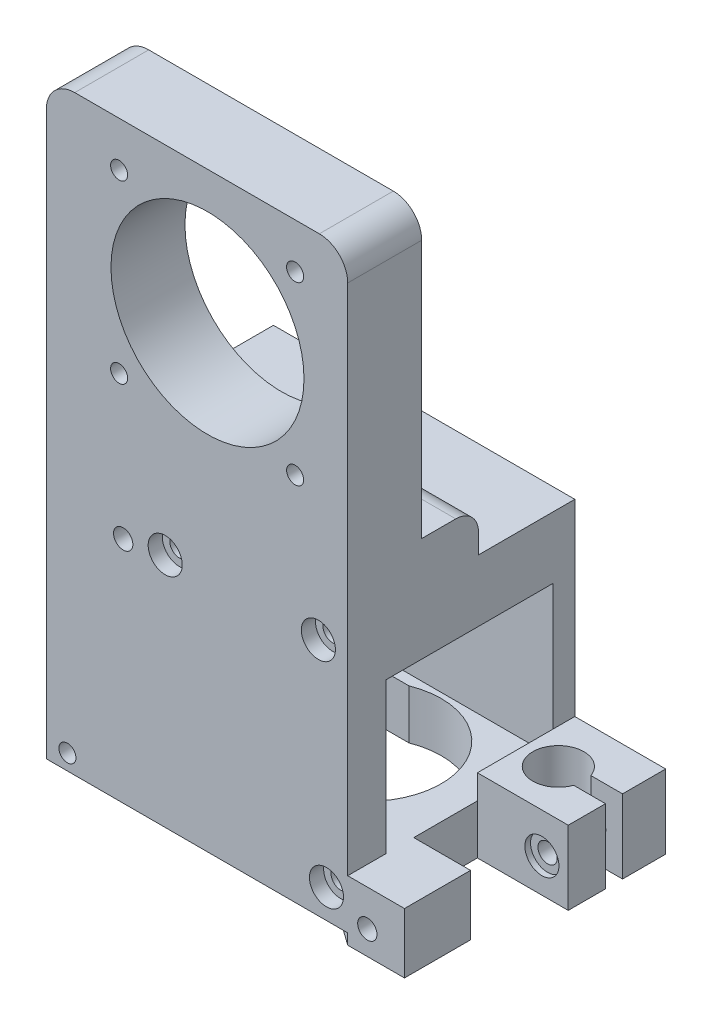
from build123d import *
from OCP.BRepAlgoAPI import BRepAlgoAPI_Cut
from OCP.TopTools import TopTools_ListOfShape

# Parameters (mm, degrees)
SKETCH1_W                     = 45
SKETCH1_H                     = 45
BOSS_EXTRUDE1_DEPTH           = 35
SKETCH2_R                     = 13
CUT_EXTRUDE3_DEPTH            = 35
SKETCH4_R                     = 1.7
CUT_EXTRUDE8_DEPTH            = 35
SKETCH7_R                     = 1.7
CUT_EXTRUDE9_DEPTH            = 35
SKETCH6_R                     = 1.7
CUT_EXTRUDE10_DEPTH           = 35
SKETCH5_R                     = 1.7
CUT_EXTRUDE11_DEPTH           = 35
CUT_EXTRUDE12_DEPTH           = 12
BOSS_EXTRUDE4_DEPTH           = 2
BOSS_EXTRUDE4_DEPTH_BACK      = 37.5
SKETCH14_W                    = 6
SKETCH14_H                    = 6
CUT_EXTRUDE17_START           = -7
SKETCH20_R                    = 2.2
CUT_EXTRUDE17_DEPTH           = 70.77141069
SKETCH21_R                    = 1.75
CUT_EXTRUDE18_DEPTH           = 2
BOSS_EXTRUDE5_DEPTH           = 44.571207257
BOSS_EXTRUDE5_DEPTH_BACK      = 1.562633388
SKETCH22_W                    = 53.082637552
SKETCH22_H                    = 40.002520942
SKETCH23_W                    = 29.449729346
SKETCH23_H                    = 26.517519529
CUT_EXTRUDE19_DEPTH           = 95.427299018
SKETCH25_R                    = 5
CUT_EXTRUDE24_DEPTH           = 2.6
SKETCH26_R                    = 8.1
CUT_EXTRUDE25_DEPTH           = 4
SKETCH27_R                    = 6.7
CUT_EXTRUDE28_DEPTH           = 6
SKETCH30_R                    = 13
CUT_EXTRUDE30_DEPTH           = 10.767560088
SKETCH31_W                    = 19.349450051
SKETCH31_H                    = 23.644133728
CUT_EXTRUDE31_DEPTH           = 9.664293754
SKETCH34_R                    = 1.5
CUT_EXTRUDE32_DEPTH           = 9
SKETCH37_W                    = 11.635024897
SKETCH37_H                    = 10.599921236
BOSS_EXTRUDE6_DEPTH           = 10
BOSS_EXTRUDE6_OTHER_WAY_DEPTH = 5
BOSS_EXTRUDE6_OTHER_WAY_TAPER = 29
SKETCH38_R                    = 1.700000001
CUT_EXTRUDE33_DEPTH           = 10
SKETCH39_R                    = 1.700000001
CUT_EXTRUDE34_DEPTH           = 88.0662855
SKETCH40_W                    = 17.159872711
SKETCH40_H                    = 13
BOSS_EXTRUDE7_DEPTH           = 16
SKETCH41_R                    = 4.5
CUT_EXTRUDE35_DEPTH           = 15
SKETCH42_W                    = 9.331425876
SKETCH42_H                    = 3
CUT_EXTRUDE36_DEPTH           = 15
CUT_EXTRUDE37_DEPTH           = 5
SKETCH44_R                    = 1.7
CUT_EXTRUDE38_DEPTH           = 23
CUT_EXTRUDE39_DEPTH           = 5
CUT_EXTRUDE40_DEPTH           = 5
CUT_EXTRUDE41_DEPTH           = 5
SKETCH53_R                    = 1.7
CUT_EXTRUDE42_DEPTH           = 90.646740997
SKETCH52_R                    = 1.7
CUT_EXTRUDE43_DEPTH           = 90.646740997
SKETCH51_R                    = 1.7
CUT_EXTRUDE44_DEPTH           = 90.646740997
CUT_EXTRUDE46_DEPTH           = 5
SKETCH57_R                    = 3
CUT_EXTRUDE48_DEPTH           = 2.5
SKETCH58_R                    = 3
CUT_EXTRUDE49_DEPTH           = 2.5
SKETCH59_R                    = 3
CUT_EXTRUDE50_DEPTH           = 2.5
SKETCH60_R                    = 3
CUT_EXTRUDE51_DEPTH           = 1
SKETCH61_W                    = 6.542017971
SKETCH61_H                    = 14.030300317
CUT_EXTRUDE52_DEPTH           = 6.5
SKETCH67_W                    = 5.604230097
SKETCH67_H                    = 8.996545788
BOSS_EXTRUDE8_DEPTH           = 33
SKETCH68_W                    = 5.604230097
SKETCH68_H                    = 9.400155495
BOSS_EXTRUDE9_DEPTH           = 33
SKETCH63_R                    = 1.7
CUT_EXTRUDE55_DEPTH           = 102.92049818
SKETCH62_R                    = 1.7
CUT_EXTRUDE56_DEPTH           = 102.92049818
SKETCH69_R                    = 3
CUT_EXTRUDE57_DEPTH           = 2.5
CUT_EXTRUDE58_DEPTH           = 2.5
SKETCH71_R                    = 3
CUT_EXTRUDE59_DEPTH           = 1
SKETCH73_R                    = 1.5
CUT_EXTRUDE61_DEPTH           = 5
SKETCH79_W                    = 95.658931194
SKETCH79_H                    = 51.290788201
CUT_EXTRUDE62_DEPTH           = 59
SKETCH80_W                    = 53.082637552
SKETCH80_H                    = 13.031868173
BOSS_EXTRUDE10_DEPTH          = 58
FILLET1_R                     = 5
SKETCH84_R                    = 17
CUT_EXTRUDE63_DEPTH           = 22
SKETCH85_R                    = 1.5
CUT_EXTRUDE64_DEPTH           = 15
SKETCH86_W                    = 13.696128452
SKETCH86_H                    = 10
BOSS_EXTRUDE11_DEPTH          = 7.5
FILLET3_R                     = 3
SKETCH87_W                    = 10.765748292
SKETCH87_H                    = 10
BOSS_EXTRUDE12_DEPTH          = 7.5
FILLET6_R                     = 4


with BuildPart() as part:
    # Sketch1 → Boss-Extrude1 (new body)
    with BuildSketch(Plane.XY):
        Rectangle(SKETCH1_W, SKETCH1_H)
    extrude(amount=BOSS_EXTRUDE1_DEPTH)

    # Sketch2 → Cut-Extrude3 (cut)
    with BuildSketch(Plane.XY.offset(35)):
        Circle(SKETCH2_R)
    extrude(amount=-CUT_EXTRUDE3_DEPTH, mode=Mode.SUBTRACT)

    # Sketch4 → Cut-Extrude8 (cut)
    with BuildSketch(Plane(origin=(0, 0, 0), x_dir=(-1, 0, 0), z_dir=(0, 0, -1))):
        with Locations((-15.808862622, 15.928817575)):
            Circle(SKETCH4_R)
    extrude(amount=-CUT_EXTRUDE8_DEPTH, mode=Mode.SUBTRACT)

    # Sketch7 → Cut-Extrude9 (cut)
    with BuildSketch(Plane(origin=(0, 0, 0), x_dir=(-1, 0, 0), z_dir=(0, 0, -1))):
        with Locations((15.199970606, 15.923392722)):
            Circle(SKETCH7_R)
    extrude(amount=-CUT_EXTRUDE9_DEPTH, mode=Mode.SUBTRACT)

    # Sketch6 → Cut-Extrude10 (cut)
    with BuildSketch(Plane(origin=(0, 0, 0), x_dir=(-1, 0, 0), z_dir=(0, 0, -1))):
        with Locations((15.22029943, -15.065721832)):
            Circle(SKETCH6_R)
    extrude(amount=-CUT_EXTRUDE10_DEPTH, mode=Mode.SUBTRACT)

    # Sketch5 → Cut-Extrude11 (cut)
    with BuildSketch(Plane(origin=(0, 0, 0), x_dir=(-1, 0, 0), z_dir=(0, 0, -1))):
        with Locations((-15.781319068, -15.06525873)):
            Circle(SKETCH5_R)
    extrude(amount=-CUT_EXTRUDE11_DEPTH, mode=Mode.SUBTRACT)

    # Sketch8 → Cut-Extrude12 (cut)
    with BuildSketch(Plane(origin=(22.5, 0, 0), x_dir=(0, 0, -1), z_dir=(1, 0, 0))):
        Polygon((-4.363915061, -12.036124724), (-35, -12.036124724), (-35, 22.5), (-8.423058519, 22.5), (-8.423058519, 12.925541512), (-4.363915061, 12.925541512), align=None)
    extrude(amount=-CUT_EXTRUDE12_DEPTH, mode=Mode.SUBTRACT)

    # Sketch14 → Boss-Extrude4 (add, two sides: drawn at the far end of the back side and taken through both)
    with BuildSketch(Plane(origin=(0, 22.5, 0), x_dir=(1, 0, 0), z_dir=(0, 1, 0)).offset(-BOSS_EXTRUDE4_DEPTH_BACK)):
        with Locations((6.190916669, -17.729312446)):
            Rectangle(SKETCH14_W, SKETCH14_H)
    extrude(amount=BOSS_EXTRUDE4_DEPTH + BOSS_EXTRUDE4_DEPTH_BACK)

    # Sketch20 → Cut-Extrude17 (cut)
    with BuildSketch(Plane(origin=(0, 24.5, 0), x_dir=(1, 0, 0), z_dir=(0, 1, 0)).offset(CUT_EXTRUDE17_START)):
        with Locations((6.190916669, -17.729312446)):
            Circle(SKETCH20_R)
    cut_extrude17 = extrude(amount=CUT_EXTRUDE17_DEPTH, mode=Mode.SUBTRACT)

    # Sketch21 → Cut-Extrude18 (cut)
    with BuildSketch(Plane(origin=(0, 17.5, 0), x_dir=(1, 0, 0), z_dir=(0, 1, 0))):
        with Locations((6.190916669, -17.729312446)):
            Circle(SKETCH21_R)
    extrude(amount=-CUT_EXTRUDE18_DEPTH, mode=Mode.SUBTRACT)

    # Mirror6: Cut-Extrude17 across plane
    add(cut_extrude17.mirror(Plane.ZX.offset(16.5)), mode=Mode.SUBTRACT)

    # Sketch22 → Boss-Extrude5 (add, two sides: drawn at the far end of the back side and taken through both)
    with BuildSketch(Plane.XZ.offset(22.5).offset(-BOSS_EXTRUDE5_DEPTH_BACK)):
        with Locations((-1.541318776, 20.001258793)):
            Rectangle(SKETCH22_W, SKETCH22_H)
    extrude(amount=BOSS_EXTRUDE5_DEPTH + BOSS_EXTRUDE5_DEPTH_BACK)

    # Sketch23 → Cut-Extrude19 (cut, through all)
    with BuildSketch(Plane.ZY.offset(28.082637552)):
        with Locations((18.529138975, -45.100264067)):
            Rectangle(SKETCH23_W, SKETCH23_H)
    extrude(amount=-CUT_EXTRUDE19_DEPTH, mode=Mode.SUBTRACT)

    # Sketch25 → Cut-Extrude24 (cut)
    with BuildSketch(Plane(origin=(0, -20.937366612, 0), x_dir=(1, 0, 0), z_dir=(0, 1, 0))):
        with Locations((6.190916669, -17.729312446)):
            Circle(SKETCH25_R)
    extrude(amount=-CUT_EXTRUDE24_DEPTH, mode=Mode.SUBTRACT)

    # Sketch26 → Cut-Extrude25 (cut)
    with BuildSketch(Plane(origin=(0, -23.537366612, 0), x_dir=(1, 0, 0), z_dir=(0, 1, 0))):
        with Locations((6.190916669, -17.729312446)):
            Circle(SKETCH26_R)
    extrude(amount=-CUT_EXTRUDE25_DEPTH, mode=Mode.SUBTRACT)

    # Sketch27 → Cut-Extrude28 (cut)
    with BuildSketch(Plane(origin=(0, -27.537366612, 0), x_dir=(1, 0, 0), z_dir=(0, 1, 0))):
        with Locations((6.190916669, -17.729312446)):
            Circle(SKETCH27_R)
    extrude(amount=-CUT_EXTRUDE28_DEPTH, mode=Mode.SUBTRACT)

    # Sketch30 → Cut-Extrude30 (cut)
    with BuildSketch(Plane(origin=(0, -58.359023831, 0), x_dir=(1, 0, 0), z_dir=(0, 1, 0))):
        with Locations((6.207851035, -17.729312446)):
            Circle(SKETCH30_R)
    extrude(amount=-CUT_EXTRUDE30_DEPTH, mode=Mode.SUBTRACT)

    # Sketch31 → Cut-Extrude31 (cut)
    with BuildSketch(Plane.XZ.offset(67.071207257)):
        with Locations((-7.592166715, 17.462222744)):
            Rectangle(SKETCH31_W, SKETCH31_H)
    extrude(amount=-CUT_EXTRUDE31_DEPTH, mode=Mode.SUBTRACT)

    # Sketch34 → Cut-Extrude32 (cut)
    with BuildSketch(Plane.ZY.offset(28.082637552)):
        with Locations((35.530918006, -28.494957131)):
            Circle(SKETCH34_R)
        with Locations((3.530918006, -28.494957131)):
            Circle(SKETCH34_R)
        with Locations((35.530918006, -60.494957131)):
            Circle(SKETCH34_R)
        with Locations((3.530918006, -60.494957131)):
            Circle(SKETCH34_R)
    extrude(amount=-CUT_EXTRUDE32_DEPTH, mode=Mode.SUBTRACT)

    # Sketch37 → Boss-Extrude6 (add)
    with BuildSketch(Plane(origin=(25, 0, 0), x_dir=(0, 0, -1), z_dir=(1, 0, 0))):
        with Locations((-34.185004037, -63.658986353)):
            Rectangle(SKETCH37_W, SKETCH37_H)
    extrude(amount=BOSS_EXTRUDE6_DEPTH)

    # Sketch37 → Boss-Extrude6 other way (add)
    with BuildSketch(Plane(origin=(25, 0, 0), x_dir=(0, 0, -1), z_dir=(1, 0, 0))):
        with Locations((-34.185004037, -63.658986353)):
            Rectangle(SKETCH37_W, SKETCH37_H)
    extrude(amount=-BOSS_EXTRUDE6_OTHER_WAY_DEPTH, taper=BOSS_EXTRUDE6_OTHER_WAY_TAPER)

    # Sketch38 → Cut-Extrude33 (cut)
    with BuildSketch(Plane.XY.offset(40.002519264)):
        with Locations((28.454234576, -64.748396147)):
            Circle(SKETCH38_R)
    extrude(amount=-CUT_EXTRUDE33_DEPTH, mode=Mode.SUBTRACT)

    # Sketch39 → Cut-Extrude34 (cut, through all)
    with BuildSketch(Plane.XY.offset(40.002519264)):
        with Locations((-14.545765424, -26.748396147)):
            Circle(SKETCH39_R)
    extrude(amount=-CUT_EXTRUDE34_DEPTH, mode=Mode.SUBTRACT)

    # Sketch40 → Boss-Extrude7 (add)
    with BuildSketch(Plane(origin=(25, 0, 0), x_dir=(0, 0, -1), z_dir=(1, 0, 0))):
        with Locations((-8.579933523, -60.571207257)):
            Rectangle(SKETCH40_W, SKETCH40_H)
    extrude(amount=BOSS_EXTRUDE7_DEPTH)

    # Sketch41 → Cut-Extrude35 (cut)
    with BuildSketch(Plane(origin=(0, -54.071207257, 1.269334023), x_dir=(1, 0, 0), z_dir=(0, 1, 0))):
        with Locations((31.163890056, -7.793414205)):
            Circle(SKETCH41_R)
    extrude(amount=-CUT_EXTRUDE35_DEPTH, mode=Mode.SUBTRACT)

    # Sketch42 → Cut-Extrude36 (cut)
    with BuildSketch(Plane(origin=(0, -54.071207257, 0), x_dir=(1, 0, 0), z_dir=(0, 1, 0))):
        with Locations((38.19390682, -9.095710432)):
            Rectangle(SKETCH42_W, SKETCH42_H)
    extrude(amount=-CUT_EXTRUDE36_DEPTH, mode=Mode.SUBTRACT)


with BuildPart() as cut_extrude37_tool:
    # Sketch43 → Cut-Extrude37 (new body)
    with BuildSketch(Plane(origin=(0, 0, 0), x_dir=(-1, 0, 0), z_dir=(0, 0, -1))):
        Polygon((-34.628927379, -64.403909926), (-32.738460245, -61.095415705), (-34.658466721, -57.80397603), (-38.468940333, -57.821030577), (-40.359407467, -61.129524799), (-38.439400991, -64.420964473), align=None)
    extrude(amount=-CUT_EXTRUDE37_DEPTH)


with BuildPart() as part_1:
    add(part.part)

    # Cut-Extrude37: cut by cut_extrude37_tool, with a tolerance
    cut_extrude37_stock = TopTools_ListOfShape()
    cut_extrude37_stock.Append(part_1.part.wrapped)
    cut_extrude37_tools = TopTools_ListOfShape()
    cut_extrude37_tools.Append(cut_extrude37_tool.part.wrapped)
    cut_extrude37_cut = BRepAlgoAPI_Cut()
    cut_extrude37_cut.SetArguments(cut_extrude37_stock)
    cut_extrude37_cut.SetTools(cut_extrude37_tools)
    cut_extrude37_cut.SetFuzzyValue(0.00001)
    cut_extrude37_cut.Build()
    add(Compound.cast(cut_extrude37_cut.Shape()).solids(), mode=Mode.REPLACE)

    # Sketch44 → Cut-Extrude38 (cut)
    with BuildSketch(Plane.XY.offset(17.159869878)):
        with Locations((36.360549159, -61.087091915)):
            Circle(SKETCH44_R)
    extrude(amount=-CUT_EXTRUDE38_DEPTH, mode=Mode.SUBTRACT)


with BuildPart() as cut_extrude39_tool:
    # Sketch48 → Cut-Extrude39 (new body)
    with BuildSketch(Plane(origin=(0, 0, 0), x_dir=(-1, 0, 0), z_dir=(0, 0, -1))):
        Polygon((9.066729233, -28.811078933), (10.957196368, -25.502584711), (9.037189891, -22.211145037), (5.22671628, -22.228199584), (3.336249145, -25.536693806), (5.256255622, -28.82813348), align=None)
    extrude(amount=-CUT_EXTRUDE39_DEPTH)


with BuildPart() as part_2:
    add(part_1.part)

    # Cut-Extrude39: cut by cut_extrude39_tool, with a tolerance
    cut_extrude39_stock = TopTools_ListOfShape()
    cut_extrude39_stock.Append(part_2.part.wrapped)
    cut_extrude39_tools = TopTools_ListOfShape()
    cut_extrude39_tools.Append(cut_extrude39_tool.part.wrapped)
    cut_extrude39_cut = BRepAlgoAPI_Cut()
    cut_extrude39_cut.SetArguments(cut_extrude39_stock)
    cut_extrude39_cut.SetTools(cut_extrude39_tools)
    cut_extrude39_cut.SetFuzzyValue(0.00001)
    cut_extrude39_cut.Build()
    add(Compound.cast(cut_extrude39_cut.Shape()).solids(), mode=Mode.REPLACE)


with BuildPart() as cut_extrude40_tool:
    # Sketch49 → Cut-Extrude40 (new body)
    with BuildSketch(Plane(origin=(0, 0, 0), x_dir=(-1, 0, 0), z_dir=(0, 0, -1))):
        Polygon((-19.339505263, -65.26594849), (-17.449038128, -61.957454268), (-19.369044605, -58.666014594), (-23.179518216, -58.683069141), (-25.06998535, -61.991563363), (-23.149978874, -65.283003037), align=None)
    extrude(amount=-CUT_EXTRUDE40_DEPTH)


with BuildPart() as part_3:
    add(part_2.part)

    # Cut-Extrude40: cut by cut_extrude40_tool, with a tolerance
    cut_extrude40_stock = TopTools_ListOfShape()
    cut_extrude40_stock.Append(part_3.part.wrapped)
    cut_extrude40_tools = TopTools_ListOfShape()
    cut_extrude40_tools.Append(cut_extrude40_tool.part.wrapped)
    cut_extrude40_cut = BRepAlgoAPI_Cut()
    cut_extrude40_cut.SetArguments(cut_extrude40_stock)
    cut_extrude40_cut.SetTools(cut_extrude40_tools)
    cut_extrude40_cut.SetFuzzyValue(0.00001)
    cut_extrude40_cut.Build()
    add(Compound.cast(cut_extrude40_cut.Shape()).solids(), mode=Mode.REPLACE)


with BuildPart() as cut_extrude41_tool:
    # Sketch50 → Cut-Extrude41 (new body)
    with BuildSketch(Plane(origin=(0, 0, 0), x_dir=(-1, 0, 0), z_dir=(0, 0, -1))):
        Polygon((-17.911640095, -28.243498116), (-16.02117296, -24.935003895), (-17.941179437, -21.64356422), (-21.751653048, -21.660618767), (-23.642120183, -24.969112989), (-21.722113706, -28.260552663), align=None)
    extrude(amount=-CUT_EXTRUDE41_DEPTH)


with BuildPart() as part_4:
    add(part_3.part)

    # Cut-Extrude41: cut by cut_extrude41_tool, with a tolerance
    cut_extrude41_stock = TopTools_ListOfShape()
    cut_extrude41_stock.Append(part_4.part.wrapped)
    cut_extrude41_tools = TopTools_ListOfShape()
    cut_extrude41_tools.Append(cut_extrude41_tool.part.wrapped)
    cut_extrude41_cut = BRepAlgoAPI_Cut()
    cut_extrude41_cut.SetArguments(cut_extrude41_stock)
    cut_extrude41_cut.SetTools(cut_extrude41_tools)
    cut_extrude41_cut.SetFuzzyValue(0.00001)
    cut_extrude41_cut.Build()
    add(Compound.cast(cut_extrude41_cut.Shape()).solids(), mode=Mode.REPLACE)

    # Sketch53 → Cut-Extrude42 (cut, through all)
    with BuildSketch(Plane.XY.offset(40.002519264)):
        with Locations((21.259511739, -61.974508816)):
            Circle(SKETCH53_R)
    extrude(amount=-CUT_EXTRUDE42_DEPTH, mode=Mode.SUBTRACT)

    # Sketch52 → Cut-Extrude43 (cut, through all)
    with BuildSketch(Plane.XY.offset(40.002519264)):
        with Locations((19.831646572, -24.952058442)):
            Circle(SKETCH52_R)
    extrude(amount=-CUT_EXTRUDE43_DEPTH, mode=Mode.SUBTRACT)

    # Sketch51 → Cut-Extrude44 (cut, through all)
    with BuildSketch(Plane.XY.offset(40.002519264)):
        with Locations((-7.146722757, -25.519639258)):
            Circle(SKETCH51_R)
    extrude(amount=-CUT_EXTRUDE44_DEPTH, mode=Mode.SUBTRACT)


with BuildPart() as cut_extrude46_tool:
    # Sketch55 → Cut-Extrude46 (new body)
    with BuildSketch(Plane(origin=(0, 0, 0), x_dir=(-1, 0, 0), z_dir=(0, 0, -1))):
        Polygon((16.584868726, -29.967411171), (18.353065861, -26.591988399), (16.313962559, -23.372973375), (12.506662122, -23.529381124), (10.738464987, -26.904803896), (12.77756829, -30.12381892), align=None)
    extrude(amount=-CUT_EXTRUDE46_DEPTH)


with BuildPart() as part_5:
    add(part_4.part)

    # Cut-Extrude46: cut by cut_extrude46_tool, with a tolerance
    cut_extrude46_stock = TopTools_ListOfShape()
    cut_extrude46_stock.Append(part_5.part.wrapped)
    cut_extrude46_tools = TopTools_ListOfShape()
    cut_extrude46_tools.Append(cut_extrude46_tool.part.wrapped)
    cut_extrude46_cut = BRepAlgoAPI_Cut()
    cut_extrude46_cut.SetArguments(cut_extrude46_stock)
    cut_extrude46_cut.SetTools(cut_extrude46_tools)
    cut_extrude46_cut.SetFuzzyValue(0.00001)
    cut_extrude46_cut.Build()
    add(Compound.cast(cut_extrude46_cut.Shape()).solids(), mode=Mode.REPLACE)

    # Sketch57 → Cut-Extrude48 (cut)
    with BuildSketch(Plane.XY.offset(40.002519264)):
        with Locations((-7.146722757, -25.519639258)):
            Circle(SKETCH57_R)
    extrude(amount=-CUT_EXTRUDE48_DEPTH, mode=Mode.SUBTRACT)

    # Sketch58 → Cut-Extrude49 (cut)
    with BuildSketch(Plane.XY.offset(40.002519264)):
        with Locations((19.831646572, -24.952058442)):
            Circle(SKETCH58_R)
    extrude(amount=-CUT_EXTRUDE49_DEPTH, mode=Mode.SUBTRACT)

    # Sketch59 → Cut-Extrude50 (cut)
    with BuildSketch(Plane.XY.offset(40.002519264)):
        with Locations((21.259511739, -61.974508816)):
            Circle(SKETCH59_R)
    extrude(amount=-CUT_EXTRUDE50_DEPTH, mode=Mode.SUBTRACT)

    # Sketch60 → Cut-Extrude51 (cut)
    with BuildSketch(Plane(origin=(0, 0, 0), x_dir=(-1, 0, 0), z_dir=(0, 0, -1))):
        with Locations((-15.808862622, 15.928817575)):
            Circle(SKETCH60_R)
        with Locations((15.199970606, 15.923392722)):
            Circle(SKETCH60_R)
        with Locations((-15.781319068, -15.06525873)):
            Circle(SKETCH60_R)
        with Locations((15.22029943, -15.065721832)):
            Circle(SKETCH60_R)
    extrude(amount=-CUT_EXTRUDE51_DEPTH, mode=Mode.SUBTRACT)

    # Sketch61 → Cut-Extrude52 (cut)
    with BuildSketch(Plane(origin=(9.190916669, 0, 0), x_dir=(0, 0, -1), z_dir=(1, 0, 0))):
        with Locations((-17.812553374, 0.202623489)):
            Rectangle(SKETCH61_W, SKETCH61_H)
    extrude(amount=-CUT_EXTRUDE52_DEPTH, mode=Mode.SUBTRACT)

    # Sketch67 → Boss-Extrude8 (add)
    with BuildSketch(Plane(origin=(-22.5, -2.468350024, 0), x_dir=(0, 0, 1), z_dir=(-1, 0, 0))):
        with Locations((29.51622543, -5.940778019)):
            Rectangle(SKETCH67_W, SKETCH67_H)
    extrude(amount=-BOSS_EXTRUDE8_DEPTH)

    # Sketch68 → Boss-Extrude9 (add)
    with BuildSketch(Plane(origin=(-22.5, -2.468350024, 0), x_dir=(0, 0, 1), z_dir=(-1, 0, 0))):
        with Locations((9.47264346, -5.966332429)):
            Rectangle(SKETCH68_W, SKETCH68_H)
    extrude(amount=-BOSS_EXTRUDE9_DEPTH)

    # Sketch63 → Cut-Extrude55 (cut, through all)
    with BuildSketch(Plane.ZY.offset(22.5)):
        with Locations((29.516225429, -7.068802512)):
            Circle(SKETCH63_R)
    extrude(amount=-CUT_EXTRUDE55_DEPTH, mode=Mode.SUBTRACT)

    # Sketch62 → Cut-Extrude56 (cut, through all)
    with BuildSketch(Plane.ZY.offset(22.5)):
        with Locations((9.403782955, -7.127149089)):
            Circle(SKETCH62_R)
    extrude(amount=-CUT_EXTRUDE56_DEPTH, mode=Mode.SUBTRACT)

    # Sketch69 → Cut-Extrude57 (cut)
    with BuildSketch(Plane.ZY.offset(22.5)):
        with Locations((9.403782955, -7.127149089)):
            Circle(SKETCH69_R)
        with Locations((29.516225429, -7.068802512)):
            Circle(SKETCH69_R)
    extrude(amount=-CUT_EXTRUDE57_DEPTH, mode=Mode.SUBTRACT)

    # Sketch70 → Cut-Extrude58 (cut)
    with BuildSketch(Plane(origin=(0, 0, 28.367491588), x_dir=(-1, 0, 0), z_dir=(0, 0, -1))):
        Polygon((-25.203073508, -66.735844691), (-25.107473115, -62.926532343), (-28.358634183, -60.939083799), (-31.705395644, -62.760947604), (-31.800996037, -66.570259952), (-28.549834969, -68.557708495), align=None)
    extrude(amount=-CUT_EXTRUDE58_DEPTH, mode=Mode.SUBTRACT)

    # Sketch71 → Cut-Extrude59 (cut)
    with BuildSketch(Plane.XY.offset(17.159869878)):
        with Locations((36.360549159, -61.087091915)):
            Circle(SKETCH71_R)
    extrude(amount=-CUT_EXTRUDE59_DEPTH, mode=Mode.SUBTRACT)

    # Sketch73 → Cut-Extrude61 (cut)
    with BuildSketch(Plane.XY.offset(40.002519264)):
        with Locations((-24.369276222, -64.32278971)):
            Circle(SKETCH73_R)
    extrude(amount=-CUT_EXTRUDE61_DEPTH, mode=Mode.SUBTRACT)

    # Sketch79 → Cut-Extrude62 (cut)
    with BuildSketch(Plane(origin=(0, -20.937366612, 0), x_dir=(1, 0, 0), z_dir=(0, 1, 0))):
        with Locations((-4.270574665, -23.740541644)):
            Rectangle(SKETCH79_W, SKETCH79_H)
    extrude(amount=CUT_EXTRUDE62_DEPTH, mode=Mode.SUBTRACT)

    # Sketch80 → Boss-Extrude10 (add)
    with BuildSketch(Plane(origin=(0, -20.937366612, 0), x_dir=(1, 0, 0), z_dir=(0, 1, 0))):
        with Locations((-1.541318776, -33.486585178)):
            Rectangle(SKETCH80_W, SKETCH80_H)
    extrude(amount=BOSS_EXTRUDE10_DEPTH)

    # Fillet1
    fillet1_edges = [part_5.edges().sort_by_distance(p)[0] for p in [
        (-28.082637552, 37.062633388, 33.486585177),
        (25, 37.062633388, 33.486585177),
    ]]
    fillet(fillet1_edges, radius=FILLET1_R)

    # Sketch84 → Cut-Extrude63 (cut)
    with BuildSketch(Plane(origin=(0, 0, 26.970651091), x_dir=(-1, 0, 0), z_dir=(0, 0, -1))):
        with Locations((-0.29898878, 13.603645853)):
            Circle(SKETCH84_R)
    extrude(amount=-CUT_EXTRUDE63_DEPTH, mode=Mode.SUBTRACT)

    # Sketch85 → Cut-Extrude64 (cut)
    with BuildSketch(Plane.XY.offset(40.002519264)):
        with Locations((15.736832887, 29.13557467)):
            Circle(SKETCH85_R)
        with Locations((15.736832887, -1.86442533)):
            Circle(SKETCH85_R)
        with Locations((-15.263167113, -1.86442533)):
            Circle(SKETCH85_R)
        with Locations((-15.263167113, 29.13557467)):
            Circle(SKETCH85_R)
    extrude(amount=-CUT_EXTRUDE64_DEPTH, mode=Mode.SUBTRACT)

    # Sketch86 → Boss-Extrude11 (add)
    with BuildSketch(Plane(origin=(0, -20.937366612, 0), x_dir=(1, 0, 0), z_dir=(0, 1, 0))):
        with Locations((-21.234573326, -21.970651091)):
            Rectangle(SKETCH86_W, SKETCH86_H)
    extrude(amount=BOSS_EXTRUDE11_DEPTH)

    # Fillet3
    fillet3_edges = [part_5.edges().sort_by_distance(p)[0] for p in [
        (-21.234573326, -13.437366612, 16.970651091),
    ]]
    fillet(fillet3_edges, radius=FILLET3_R)

    # Sketch87 → Boss-Extrude12 (add)
    with BuildSketch(Plane(origin=(0, -20.937366612, 0), x_dir=(1, 0, 0), z_dir=(0, 1, 0))):
        with Locations((19.617125854, -21.970651091)):
            Rectangle(SKETCH87_W, SKETCH87_H)
    extrude(amount=BOSS_EXTRUDE12_DEPTH)

    # Fillet6
    fillet6_edges = [part_5.edges().sort_by_distance(p)[0] for p in [
        (19.617125854, -13.437366612, 16.970651091),
    ]]
    fillet(fillet6_edges, radius=FILLET6_R)


solid = part_5.part
